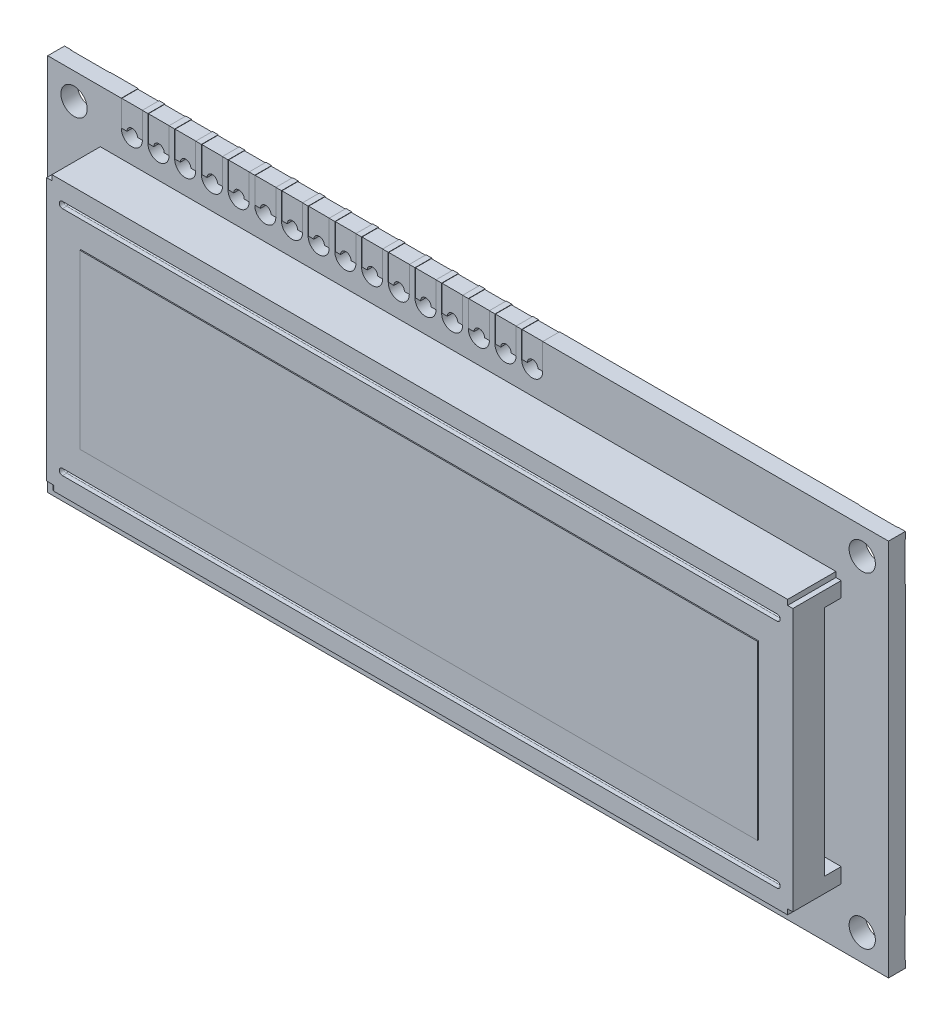
from build123d import *

# Parameters (mm, degrees)
SKETCH1_W                         = 70
SKETCH1_H                         = 26
BOSS_EXTRUDE1_DEPTH               = 4.6
SKETCH2_W                         = 4.6
SKETCH2_H                         = 25
BOSS_EXTRUDE2_DEPTH               = 0.5
SKETCH3_W                         = 4.6
SKETCH3_H                         = 25
BOSS_EXTRUDE3_DEPTH               = 0.5
SKETCH4_W                         = 71
SKETCH4_H                         = 1.6
CUT_EXTRUDE1_DEPTH                = 22.135688782
SKETCH5_W                         = 80
SKETCH5_H                         = 36
BOSS_EXTRUDE4_DEPTH               = 1.6
CUT_EXTRUDE2_DEPTH                = 45.103968075
CUT_EXTRUDE3_DEPTH                = 45.103968075
CUT_EXTRUDE4_DEPTH                = 45.103968075
CUT_EXTRUDE5_DEPTH                = 45.103968075
CUT_EXTRUDE6_DEPTH                = 45.103968075
CUT_EXTRUDE7_DEPTH                = 45.103968075
CUT_EXTRUDE8_DEPTH                = 45.103968075
CUT_EXTRUDE9_DEPTH                = 45.103968075
CUT_EXTRUDE10_DEPTH               = 45.103968075
CUT_EXTRUDE11_DEPTH               = 45.103968075
CUT_EXTRUDE12_DEPTH               = 45.103968075
CUT_EXTRUDE13_DEPTH               = 45.103968075
CUT_EXTRUDE14_DEPTH               = 45.103968075
CUT_EXTRUDE15_DEPTH               = 45.103968075
CUT_EXTRUDE16_DEPTH               = 45.103968075
SKETCH21_W                        = 1.52
SKETCH21_H                        = 2.47
BOSS_EXTRUDE5_DEPTH               = 2
SKETCH22_W                        = 1.52
SKETCH22_H                        = 2.47
BOSS_EXTRUDE6_DEPTH               = 2
SKETCH23_W                        = 1.52
SKETCH23_H                        = 2.47
BOSS_EXTRUDE7_DEPTH               = 2
SKETCH24_W                        = 1.52
SKETCH24_H                        = 2.47
BOSS_EXTRUDE8_DEPTH               = 2
SKETCH25_W                        = 1.52
SKETCH25_H                        = 2.47
BOSS_EXTRUDE9_DEPTH               = 2
SKETCH26_W                        = 1.52
SKETCH26_H                        = 2.47
BOSS_EXTRUDE10_DEPTH              = 2
SKETCH27_W                        = 1.52
SKETCH27_H                        = 2.47
BOSS_EXTRUDE11_DEPTH              = 2
SKETCH28_W                        = 1.52
SKETCH28_H                        = 2.47
BOSS_EXTRUDE12_DEPTH              = 2
SKETCH29_W                        = 1.52
SKETCH29_H                        = 2.47
BOSS_EXTRUDE13_DEPTH              = 2
SKETCH30_W                        = 1.52
SKETCH30_H                        = 2.47
BOSS_EXTRUDE14_DEPTH              = 2
SKETCH31_W                        = 1.52
SKETCH31_H                        = 2.47
BOSS_EXTRUDE15_DEPTH              = 2
SKETCH32_W                        = 1.52
SKETCH32_H                        = 2.47
BOSS_EXTRUDE16_DEPTH              = 2
SKETCH33_W                        = 1.52
SKETCH33_H                        = 2.47
BOSS_EXTRUDE17_DEPTH              = 2
SKETCH34_W                        = 1.52
SKETCH34_H                        = 2.47
BOSS_EXTRUDE18_DEPTH              = 2
SKETCH35_W                        = 1.52
SKETCH35_H                        = 2.47
BOSS_EXTRUDE19_DEPTH              = 2
CUT_EXTRUDE17_DEPTH               = 45.103968075
SKETCH37_W                        = 1.52
SKETCH37_H                        = 2.47
BOSS_EXTRUDE20_DEPTH              = 2
SKETCH38_W                        = 64.5
SKETCH38_H                        = 16.4
BOSS_EXTRUDE21_DEPTH              = 0.1
SKETCH39_W                        = 0.8
SKETCH39_H                        = 0.5
BOSS_EXTRUDE22_DEPTH              = 0.6
SKETCH40_W                        = 0.8
SKETCH40_H                        = 0.5
BOSS_EXTRUDE23_DEPTH              = 0.6
SKETCH41_W                        = 0.8
SKETCH41_H                        = 0.5
BOSS_EXTRUDE24_DEPTH              = 0.6
SKETCH42_W                        = 0.8
SKETCH42_H                        = 0.5
BOSS_EXTRUDE25_DEPTH              = 0.6
SKETCH43_W                        = 0.8
SKETCH43_H                        = 0.5
BOSS_EXTRUDE26_DEPTH              = 0.6
SKETCH44_W                        = 0.8
SKETCH44_H                        = 0.5
BOSS_EXTRUDE27_DEPTH              = 0.6
SKETCH45_W                        = 0.8
SKETCH45_H                        = 0.5
BOSS_EXTRUDE28_DEPTH              = 0.6
SKETCH46_W                        = 0.8
SKETCH46_H                        = 0.5
BOSS_EXTRUDE29_DEPTH              = 0.6
SKETCH47_W                        = 0.8
SKETCH47_H                        = 0.5
BOSS_EXTRUDE30_DEPTH              = 0.6
SKETCH48_W                        = 0.8
SKETCH48_H                        = 0.5
BOSS_EXTRUDE31_DEPTH              = 0.6
SKETCH49_W                        = 0.8
SKETCH49_H                        = 0.5
BOSS_EXTRUDE32_DEPTH              = 0.6
SKETCH50_W                        = 0.8
SKETCH50_H                        = 0.5
BOSS_EXTRUDE33_DEPTH              = 0.6
CUT_EXTRUDE18_DEPTH               = 0.5
CUT_EXTRUDE19_DEPTH               = 0.5
M2_5X0_45_TAPPED_HOLE1_AT_2_COUNT = 2
M2_5X0_45_TAPPED_HOLE1_AT_2_PITCH = 75
M2_5X0_45_TAPPED_HOLE1_AT_3_COUNT = 2
M2_5X0_45_TAPPED_HOLE1_AT_3_PITCH = 31
M2_5X0_45_TAPPED_HOLE1_AT_4_COUNT = 2
M2_5X0_45_TAPPED_HOLE1_AT_4_PITCH = 81.154174261
F_1_0_1_DIAMETER_HOLE1_D          = 1
F_1_0_1_DIAMETER_HOLE1_DEPTH      = 2.56
RIB1_REACH                        = 48.446
SKETCH59_WALL_W                   = 95.39246471
SKETCH59_WALL_H                   = 0.2
RIB2_REACH                        = 47.053
SKETCH60_WALL_W                   = 92.605549218
SKETCH60_WALL_H                   = 0.2
RIB3_REACH                        = 47.965
SKETCH61_WALL_W                   = 94.429375066
SKETCH61_WALL_H                   = 0.2
RIB4_REACH                        = 46.623
SKETCH62_WALL_W                   = 91.746904708
SKETCH62_WALL_H                   = 0.2
RIB5_REACH                        = 47.5
SKETCH63_WALL_W                   = 93.500054946
SKETCH63_WALL_H                   = 0.2
RIB6_REACH                        = 46.416
SKETCH64_WALL_W                   = 91.331357076
SKETCH64_WALL_H                   = 0.2
FILLET2_R                         = 0.2
CHAMFER1_SIZE                     = 0.05
FILLET3_R                         = 0.1


with BuildPart() as part:
    # Sketch1 → Boss-Extrude1 (new body)
    with BuildSketch(Plane.XY.offset(6.2)):
        Rectangle(SKETCH1_W, SKETCH1_H)
    extrude(amount=-BOSS_EXTRUDE1_DEPTH)

    # Sketch2 → Boss-Extrude2 (add)
    with BuildSketch(Plane.ZY.offset(35)):
        with Locations((3.9, 0)):
            Rectangle(SKETCH2_W, SKETCH2_H)
    extrude(amount=BOSS_EXTRUDE2_DEPTH)

    # Sketch3 → Boss-Extrude3 (add)
    with BuildSketch(Plane(origin=(35, 0, 0), x_dir=(0, 0, -1), z_dir=(1, 0, 0))):
        with Locations((-3.9, 0)):
            Rectangle(SKETCH3_W, SKETCH3_H)
    extrude(amount=BOSS_EXTRUDE3_DEPTH)

    # Sketch4 → Cut-Extrude1 (cut)
    with BuildSketch(Plane(origin=(0, 11.067844391, 0), x_dir=(1, 0, 0), z_dir=(0, 1, 0))):
        with Locations((0, -2.4)):
            Rectangle(SKETCH4_W, SKETCH4_H)
    extrude(amount=-CUT_EXTRUDE1_DEPTH, mode=Mode.SUBTRACT)

    # Sketch5 → Boss-Extrude4 (add)
    with BuildSketch(Plane.XY.offset(1.6)):
        Rectangle(SKETCH5_W, SKETCH5_H)
    extrude(amount=-BOSS_EXTRUDE4_DEPTH)

    # Sketch6 → Cut-Extrude2 (cut, through all)
    with BuildSketch(Plane.XY.offset(1.6)):
        with BuildLine():
            Line((-31, 18), (-33, 18))
            Line((-33, 18), (-33, 15.5))
            ThreePointArc((-33, 15.5), (-32, 14.5), (-31, 15.5))
            Line((-31, 15.5), (-31, 18))
        make_face()
    extrude(amount=-CUT_EXTRUDE2_DEPTH, mode=Mode.SUBTRACT)

    # Sketch7 → Cut-Extrude3 (cut, through all)
    with BuildSketch(Plane.XY.offset(1.6)):
        with BuildLine():
            Line((-28.46, 18), (-30.46, 18))
            Line((-30.46, 18), (-30.46, 15.5))
            ThreePointArc((-30.46, 15.5), (-29.46, 14.5), (-28.46, 15.5))
            Line((-28.46, 15.5), (-28.46, 18))
        make_face()
    extrude(amount=-CUT_EXTRUDE3_DEPTH, mode=Mode.SUBTRACT)

    # Sketch8 → Cut-Extrude4 (cut, through all)
    with BuildSketch(Plane.XY.offset(1.6)):
        with BuildLine():
            Line((-25.92, 18), (-27.92, 18))
            Line((-27.92, 18), (-27.92, 15.5))
            ThreePointArc((-27.92, 15.5), (-26.92, 14.5), (-25.92, 15.5))
            Line((-25.92, 15.5), (-25.92, 18))
        make_face()
    extrude(amount=-CUT_EXTRUDE4_DEPTH, mode=Mode.SUBTRACT)

    # Sketch9 → Cut-Extrude5 (cut, through all)
    with BuildSketch(Plane.XY.offset(1.6)):
        with BuildLine():
            Line((-23.38, 18), (-25.38, 18))
            Line((-25.38, 18), (-25.38, 15.5))
            ThreePointArc((-25.38, 15.5), (-24.38, 14.5), (-23.38, 15.5))
            Line((-23.38, 15.5), (-23.38, 18))
        make_face()
    extrude(amount=-CUT_EXTRUDE5_DEPTH, mode=Mode.SUBTRACT)

    # Sketch10 → Cut-Extrude6 (cut, through all)
    with BuildSketch(Plane.XY.offset(1.6)):
        with BuildLine():
            Line((-20.84, 18), (-22.84, 18))
            Line((-22.84, 18), (-22.84, 15.5))
            ThreePointArc((-22.84, 15.5), (-21.84, 14.5), (-20.84, 15.5))
            Line((-20.84, 15.5), (-20.84, 18))
        make_face()
    extrude(amount=-CUT_EXTRUDE6_DEPTH, mode=Mode.SUBTRACT)

    # Sketch11 → Cut-Extrude7 (cut, through all)
    with BuildSketch(Plane.XY.offset(1.6)):
        with BuildLine():
            Line((-18.3, 18), (-20.3, 18))
            Line((-20.3, 18), (-20.3, 15.5))
            ThreePointArc((-20.3, 15.5), (-19.3, 14.5), (-18.3, 15.5))
            Line((-18.3, 15.5), (-18.3, 18))
        make_face()
    extrude(amount=-CUT_EXTRUDE7_DEPTH, mode=Mode.SUBTRACT)

    # Sketch12 → Cut-Extrude8 (cut, through all)
    with BuildSketch(Plane.XY.offset(1.6)):
        with BuildLine():
            Line((-15.76, 18), (-17.76, 18))
            Line((-17.76, 18), (-17.76, 15.5))
            ThreePointArc((-17.76, 15.5), (-16.76, 14.5), (-15.76, 15.5))
            Line((-15.76, 15.5), (-15.76, 18))
        make_face()
    extrude(amount=-CUT_EXTRUDE8_DEPTH, mode=Mode.SUBTRACT)

    # Sketch13 → Cut-Extrude9 (cut, through all)
    with BuildSketch(Plane.XY.offset(1.6)):
        with BuildLine():
            Line((-13.22, 18), (-15.22, 18))
            Line((-15.22, 18), (-15.22, 15.5))
            ThreePointArc((-15.22, 15.5), (-14.22, 14.5), (-13.22, 15.5))
            Line((-13.22, 15.5), (-13.22, 18))
        make_face()
    extrude(amount=-CUT_EXTRUDE9_DEPTH, mode=Mode.SUBTRACT)

    # Sketch14 → Cut-Extrude10 (cut, through all)
    with BuildSketch(Plane.XY.offset(1.6)):
        with BuildLine():
            Line((-10.68, 18), (-12.68, 18))
            Line((-12.68, 18), (-12.68, 15.5))
            ThreePointArc((-12.68, 15.5), (-11.68, 14.5), (-10.68, 15.5))
            Line((-10.68, 15.5), (-10.68, 18))
        make_face()
    extrude(amount=-CUT_EXTRUDE10_DEPTH, mode=Mode.SUBTRACT)

    # Sketch15 → Cut-Extrude11 (cut, through all)
    with BuildSketch(Plane.XY.offset(1.6)):
        with BuildLine():
            Line((-8.14, 18), (-10.14, 18))
            Line((-10.14, 18), (-10.14, 15.5))
            ThreePointArc((-10.14, 15.5), (-9.14, 14.5), (-8.14, 15.5))
            Line((-8.14, 15.5), (-8.14, 18))
        make_face()
    extrude(amount=-CUT_EXTRUDE11_DEPTH, mode=Mode.SUBTRACT)

    # Sketch16 → Cut-Extrude12 (cut, through all)
    with BuildSketch(Plane.XY.offset(1.6)):
        with BuildLine():
            Line((-5.6, 18), (-7.6, 18))
            Line((-7.6, 18), (-7.6, 15.5))
            ThreePointArc((-7.6, 15.5), (-6.6, 14.5), (-5.6, 15.5))
            Line((-5.6, 15.5), (-5.6, 18))
        make_face()
    extrude(amount=-CUT_EXTRUDE12_DEPTH, mode=Mode.SUBTRACT)

    # Sketch17 → Cut-Extrude13 (cut, through all)
    with BuildSketch(Plane.XY.offset(1.6)):
        with BuildLine():
            Line((-3.06, 18), (-5.06, 18))
            Line((-5.06, 18), (-5.06, 15.5))
            ThreePointArc((-5.06, 15.5), (-4.06, 14.5), (-3.06, 15.5))
            Line((-3.06, 15.5), (-3.06, 18))
        make_face()
    extrude(amount=-CUT_EXTRUDE13_DEPTH, mode=Mode.SUBTRACT)

    # Sketch18 → Cut-Extrude14 (cut, through all)
    with BuildSketch(Plane.XY.offset(1.6)):
        with BuildLine():
            Line((-0.52, 18), (-2.52, 18))
            Line((-2.52, 18), (-2.52, 15.5))
            ThreePointArc((-2.52, 15.5), (-1.52, 14.5), (-0.52, 15.5))
            Line((-0.52, 15.5), (-0.52, 18))
        make_face()
    extrude(amount=-CUT_EXTRUDE14_DEPTH, mode=Mode.SUBTRACT)

    # Sketch19 → Cut-Extrude15 (cut, through all)
    with BuildSketch(Plane.XY.offset(1.6)):
        with BuildLine():
            Line((2.02, 18), (0.02, 18))
            Line((0.02, 18), (0.02, 15.5))
            ThreePointArc((0.02, 15.5), (1.02, 14.5), (2.02, 15.5))
            Line((2.02, 15.5), (2.02, 18))
        make_face()
    extrude(amount=-CUT_EXTRUDE15_DEPTH, mode=Mode.SUBTRACT)

    # Sketch20 → Cut-Extrude16 (cut, through all)
    with BuildSketch(Plane.XY.offset(1.6)):
        with BuildLine():
            Line((5.1, 18), (5.1, 15.5))
            ThreePointArc((5.1, 15.5), (6.1, 14.5), (7.1, 15.5))
            Line((7.1, 15.5), (7.1, 18))
            Line((7.1, 18), (5.1, 18))
        make_face()
    extrude(amount=-CUT_EXTRUDE16_DEPTH, mode=Mode.SUBTRACT)

    # Sketch21 → Boss-Extrude5 (add)
    with BuildSketch(Plane.ZY.offset(31)):
        with Locations((0.8, 16.735)):
            Rectangle(SKETCH21_W, SKETCH21_H)
    extrude(amount=BOSS_EXTRUDE5_DEPTH)

    # Sketch22 → Boss-Extrude6 (add)
    with BuildSketch(Plane.ZY.offset(28.46)):
        with Locations((0.8, 16.735)):
            Rectangle(SKETCH22_W, SKETCH22_H)
    extrude(amount=BOSS_EXTRUDE6_DEPTH)

    # Sketch23 → Boss-Extrude7 (add)
    with BuildSketch(Plane.ZY.offset(25.92)):
        with Locations((0.8, 16.735)):
            Rectangle(SKETCH23_W, SKETCH23_H)
    extrude(amount=BOSS_EXTRUDE7_DEPTH)

    # Sketch24 → Boss-Extrude8 (add)
    with BuildSketch(Plane.ZY.offset(23.38)):
        with Locations((0.8, 16.735)):
            Rectangle(SKETCH24_W, SKETCH24_H)
    extrude(amount=BOSS_EXTRUDE8_DEPTH)

    # Sketch25 → Boss-Extrude9 (add)
    with BuildSketch(Plane.ZY.offset(20.84)):
        with Locations((0.8, 16.735)):
            Rectangle(SKETCH25_W, SKETCH25_H)
    extrude(amount=BOSS_EXTRUDE9_DEPTH)

    # Sketch26 → Boss-Extrude10 (add)
    with BuildSketch(Plane.ZY.offset(18.3)):
        with Locations((0.8, 16.735)):
            Rectangle(SKETCH26_W, SKETCH26_H)
    extrude(amount=BOSS_EXTRUDE10_DEPTH)

    # Sketch27 → Boss-Extrude11 (add)
    with BuildSketch(Plane.ZY.offset(15.76)):
        with Locations((0.8, 16.735)):
            Rectangle(SKETCH27_W, SKETCH27_H)
    extrude(amount=BOSS_EXTRUDE11_DEPTH)

    # Sketch28 → Boss-Extrude12 (add)
    with BuildSketch(Plane.ZY.offset(13.22)):
        with Locations((0.8, 16.735)):
            Rectangle(SKETCH28_W, SKETCH28_H)
    extrude(amount=BOSS_EXTRUDE12_DEPTH)

    # Sketch29 → Boss-Extrude13 (add)
    with BuildSketch(Plane.ZY.offset(10.68)):
        with Locations((0.8, 16.735)):
            Rectangle(SKETCH29_W, SKETCH29_H)
    extrude(amount=BOSS_EXTRUDE13_DEPTH)

    # Sketch30 → Boss-Extrude14 (add)
    with BuildSketch(Plane.ZY.offset(8.14)):
        with Locations((0.8, 16.735)):
            Rectangle(SKETCH30_W, SKETCH30_H)
    extrude(amount=BOSS_EXTRUDE14_DEPTH)

    # Sketch31 → Boss-Extrude15 (add)
    with BuildSketch(Plane.ZY.offset(5.6)):
        with Locations((0.8, 16.735)):
            Rectangle(SKETCH31_W, SKETCH31_H)
    extrude(amount=BOSS_EXTRUDE15_DEPTH)

    # Sketch32 → Boss-Extrude16 (add)
    with BuildSketch(Plane.ZY.offset(3.06)):
        with Locations((0.8, 16.735)):
            Rectangle(SKETCH32_W, SKETCH32_H)
    extrude(amount=BOSS_EXTRUDE16_DEPTH)

    # Sketch33 → Boss-Extrude17 (add)
    with BuildSketch(Plane.ZY.offset(0.52)):
        with Locations((0.8, 16.735)):
            Rectangle(SKETCH33_W, SKETCH33_H)
    extrude(amount=BOSS_EXTRUDE17_DEPTH)

    # Sketch34 → Boss-Extrude18 (add)
    with BuildSketch(Plane.ZY.offset(-2.02)):
        with Locations((0.8, 16.735)):
            Rectangle(SKETCH34_W, SKETCH34_H)
    extrude(amount=BOSS_EXTRUDE18_DEPTH)

    # Sketch35 → Boss-Extrude19 (add)
    with BuildSketch(Plane.ZY.offset(-7.1)):
        with Locations((0.8, 16.735)):
            Rectangle(SKETCH35_W, SKETCH35_H)
    extrude(amount=BOSS_EXTRUDE19_DEPTH)

    # Sketch36 → Cut-Extrude17 (cut, through all)
    with BuildSketch(Plane.XY.offset(1.6)):
        with BuildLine():
            Line((4.56, 18), (2.56, 18))
            Line((2.56, 18), (2.56, 15.5))
            ThreePointArc((2.56, 15.5), (3.56, 14.5), (4.56, 15.5))
            Line((4.56, 15.5), (4.56, 18))
        make_face()
    extrude(amount=-CUT_EXTRUDE17_DEPTH, mode=Mode.SUBTRACT)

    # Sketch37 → Boss-Extrude20 (add)
    with BuildSketch(Plane.ZY.offset(-4.56)):
        with Locations((0.8, 16.735)):
            Rectangle(SKETCH37_W, SKETCH37_H)
    extrude(amount=BOSS_EXTRUDE20_DEPTH)

    # Sketch38 → Boss-Extrude21 (add)
    with BuildSketch(Plane.XY.offset(6.2)):
        Rectangle(SKETCH38_W, SKETCH38_H)
    extrude(amount=BOSS_EXTRUDE21_DEPTH)

    # Sketch39 → Boss-Extrude22 (add)
    with BuildSketch(Plane(origin=(0, 0, 0), x_dir=(-1, 0, 0), z_dir=(0, 0, -1))):
        with Locations((-30.3, 0.25)):
            Rectangle(SKETCH39_W, SKETCH39_H)
    extrude(amount=BOSS_EXTRUDE22_DEPTH)

    # Sketch40 → Boss-Extrude23 (add)
    with BuildSketch(Plane(origin=(0, 0, 0), x_dir=(-1, 0, 0), z_dir=(0, 0, -1))):
        with Locations((-31.6, 0.25)):
            Rectangle(SKETCH40_W, SKETCH40_H)
    extrude(amount=BOSS_EXTRUDE23_DEPTH)

    # Sketch41 → Boss-Extrude24 (add)
    with BuildSketch(Plane(origin=(0, 0, 0), x_dir=(-1, 0, 0), z_dir=(0, 0, -1))):
        with Locations((-30.3, -1.75)):
            Rectangle(SKETCH41_W, SKETCH41_H)
    extrude(amount=BOSS_EXTRUDE24_DEPTH)

    # Sketch42 → Boss-Extrude25 (add)
    with BuildSketch(Plane(origin=(0, 0, 0), x_dir=(-1, 0, 0), z_dir=(0, 0, -1))):
        with Locations((-31.6, -1.75)):
            Rectangle(SKETCH42_W, SKETCH42_H)
    extrude(amount=BOSS_EXTRUDE25_DEPTH)

    # Sketch43 → Boss-Extrude26 (add)
    with BuildSketch(Plane(origin=(0, 0, 0), x_dir=(-1, 0, 0), z_dir=(0, 0, -1))):
        with Locations((-30.3, -2.75)):
            Rectangle(SKETCH43_W, SKETCH43_H)
    extrude(amount=BOSS_EXTRUDE26_DEPTH)

    # Sketch44 → Boss-Extrude27 (add)
    with BuildSketch(Plane(origin=(0, 0, 0), x_dir=(-1, 0, 0), z_dir=(0, 0, -1))):
        with Locations((-31.6, -2.75)):
            Rectangle(SKETCH44_W, SKETCH44_H)
    extrude(amount=BOSS_EXTRUDE27_DEPTH)

    # Sketch45 → Boss-Extrude28 (add)
    with BuildSketch(Plane(origin=(0, 0, 0), x_dir=(-1, 0, 0), z_dir=(0, 0, -1))):
        with Locations((-30.3, -3.75)):
            Rectangle(SKETCH45_W, SKETCH45_H)
    extrude(amount=BOSS_EXTRUDE28_DEPTH)

    # Sketch46 → Boss-Extrude29 (add)
    with BuildSketch(Plane(origin=(0, 0, 0), x_dir=(-1, 0, 0), z_dir=(0, 0, -1))):
        with Locations((-31.6, -3.75)):
            Rectangle(SKETCH46_W, SKETCH46_H)
    extrude(amount=BOSS_EXTRUDE29_DEPTH)

    # Sketch47 → Boss-Extrude30 (add)
    with BuildSketch(Plane(origin=(0, 0, 0), x_dir=(-1, 0, 0), z_dir=(0, 0, -1))):
        with Locations((-30.3, -4.75)):
            Rectangle(SKETCH47_W, SKETCH47_H)
    extrude(amount=BOSS_EXTRUDE30_DEPTH)

    # Sketch48 → Boss-Extrude31 (add)
    with BuildSketch(Plane(origin=(0, 0, 0), x_dir=(-1, 0, 0), z_dir=(0, 0, -1))):
        with Locations((-31.6, -4.75)):
            Rectangle(SKETCH48_W, SKETCH48_H)
    extrude(amount=BOSS_EXTRUDE31_DEPTH)

    # Sketch49 → Boss-Extrude32 (add)
    with BuildSketch(Plane(origin=(0, 0, 0), x_dir=(-1, 0, 0), z_dir=(0, 0, -1))):
        with Locations((-31.6, -0.75)):
            Rectangle(SKETCH49_W, SKETCH49_H)
    extrude(amount=BOSS_EXTRUDE32_DEPTH)

    # Sketch50 → Boss-Extrude33 (add)
    with BuildSketch(Plane(origin=(0, 0, 0), x_dir=(-1, 0, 0), z_dir=(0, 0, -1))):
        with Locations((-30.3, -0.75)):
            Rectangle(SKETCH50_W, SKETCH50_H)
    extrude(amount=BOSS_EXTRUDE33_DEPTH)

    # Sketch51 → Cut-Extrude18 (cut)
    with BuildSketch(Plane.XY.offset(6.2)):
        with BuildLine():
            Line((34, -10.7), (-34, -10.7))
            ThreePointArc((-34, -10.7), (-34.3, -11), (-34, -11.3))
            Line((-34, -11.3), (34, -11.3))
            ThreePointArc((34, -11.3), (34.3, -11), (34, -10.7))
        make_face()
    extrude(amount=-CUT_EXTRUDE18_DEPTH, mode=Mode.SUBTRACT)

    # Sketch52 → Cut-Extrude19 (cut)
    with BuildSketch(Plane.XY.offset(6.2)):
        with BuildLine():
            Line((34, 11.3), (-34, 11.3))
            ThreePointArc((-34, 11.3), (-34.3, 11), (-34, 10.7))
            Line((-34, 10.7), (34, 10.7))
            ThreePointArc((34, 10.7), (34.3, 11), (34, 11.3))
        make_face()
    extrude(amount=-CUT_EXTRUDE19_DEPTH, mode=Mode.SUBTRACT)

    # Sketch53 → Revolve1 (revolve)
    with BuildSketch(Plane.XZ):
        with BuildLine():
            Line((-9.662109618, 0), (-14.018673897, 0))
            Line((-14.018673897, 0), (-14.018673897, -1))
            Line((-14.018673897, -1), (-11.394160426, -1))
            ThreePointArc((-11.394160426, -1), (-10.894160426, -0.866025404), (-10.528135022, -0.5))
            ThreePointArc((-10.528135022, -0.5), (-10.162109618, -0.133974596), (-9.662109618, 0))
        make_face()
    revolve(axis=Axis((-14.018673897, 0, 0), (0, 0, -1)))

    # Sketch54 → Revolve2 (revolve)
    with BuildSketch(Plane.XZ):
        with BuildLine():
            Line((23.145008603, 0), (17.197547913, 0))
            Line((17.197547913, 0), (17.197547913, -1))
            Line((17.197547913, -1), (21.412957795, -1))
            ThreePointArc((21.412957795, -1), (21.912957795, -0.866025404), (22.278983199, -0.5))
            ThreePointArc((22.278983199, -0.5), (22.645008603, -0.133974596), (23.145008603, 0))
        make_face()
    revolve(axis=Axis((17.197547913, 0, 0), (0, 0, -1)))

    # Sketch55 → M2.5x0.45 Tapped Hole1 (revolve, cut)
    with BuildSketch(Plane(origin=(-37.5, -15.5, 1.6), x_dir=(0, -1, 0), z_dir=(1, 0, 0))):
        Polygon((0, 0), (0, 2.6), (3.1, 2.6), (3.1, 1.56), (1.25, 1.56), (1.25, 0), align=None)
    m2_5x0_45_tapped_hole1 = revolve(axis=Axis((-37.5, -15.5, 7.95), (0, 0, -1)), mode=Mode.SUBTRACT)

    # M2.5x0.45 Tapped Hole1 at 2: M2.5x0.45 Tapped Hole1 ×2
    with Locations(*[(i * M2_5X0_45_TAPPED_HOLE1_AT_2_PITCH, 0, 0) for i in range(1, M2_5X0_45_TAPPED_HOLE1_AT_2_COUNT)]):
        add(m2_5x0_45_tapped_hole1, mode=Mode.SUBTRACT)

    # M2.5x0.45 Tapped Hole1 at 3: M2.5x0.45 Tapped Hole1 ×2
    with Locations(*[(0, i * M2_5X0_45_TAPPED_HOLE1_AT_3_PITCH, 0) for i in range(1, M2_5X0_45_TAPPED_HOLE1_AT_3_COUNT)]):
        add(m2_5x0_45_tapped_hole1, mode=Mode.SUBTRACT)

    # M2.5x0.45 Tapped Hole1 at 4: M2.5x0.45 Tapped Hole1 ×2
    with Locations(*[Vector(0.9241668796814523, 0.3819889769350003, 0) * (i * M2_5X0_45_TAPPED_HOLE1_AT_4_PITCH) for i in range(1, M2_5X0_45_TAPPED_HOLE1_AT_4_COUNT)]):
        add(m2_5x0_45_tapped_hole1, mode=Mode.SUBTRACT)

    # Ø1.0 (1) Diameter Hole1
    with Locations(Plane.XY.offset(1.56)):
        with Locations((6.1, 15.5), (-32, 15.5), (-29.46, 15.5), (-26.92, 15.5), (-24.38, 15.5), (-21.84, 15.5), (-19.3, 15.5), (-16.76, 15.5), (-14.22, 15.5), (-11.68, 15.5), (-9.14, 15.5), (-6.6, 15.5), (-4.06, 15.5), (-1.52, 15.5), (1.02, 15.5), (3.56, 15.5)):
            Hole(F_1_0_1_DIAMETER_HOLE1_D / 2, depth=F_1_0_1_DIAMETER_HOLE1_DEPTH)

    # Sketch59 wall → Rib1 (add, up to next)
    with BuildSketch(Plane(origin=(30.95, -4.75, -0.5), x_dir=(-1, 0, 0), z_dir=(0, 0, 1)), mode=Mode.PRIVATE) as rib1_sk1:
        Rectangle(SKETCH59_WALL_W, SKETCH59_WALL_H)
    rib1_tool1 = extrude(rib1_sk1.sketch, amount=RIB1_REACH, mode=Mode.PRIVATE) - part.part
    add(rib1_tool1.solids().sort_by_distance((30.95, -4.75, -0.5))[0])

    # Sketch60 wall → Rib2 (add, up to next)
    with BuildSketch(Plane(origin=(30.95, -1.75, -0.5), x_dir=(-1, 0, 0), z_dir=(0, 0, 1)), mode=Mode.PRIVATE) as rib2_sk1:
        Rectangle(SKETCH60_WALL_W, SKETCH60_WALL_H)
    rib2_tool1 = extrude(rib2_sk1.sketch, amount=RIB2_REACH, mode=Mode.PRIVATE) - part.part
    add(rib2_tool1.solids().sort_by_distance((30.95, -1.75, -0.5))[0])

    # Sketch61 wall → Rib3 (add, up to next)
    with BuildSketch(Plane(origin=(30.95, -3.75, -0.5), x_dir=(-1, 0, 0), z_dir=(0, 0, 1)), mode=Mode.PRIVATE) as rib3_sk1:
        Rectangle(SKETCH61_WALL_W, SKETCH61_WALL_H)
    rib3_tool1 = extrude(rib3_sk1.sketch, amount=RIB3_REACH, mode=Mode.PRIVATE) - part.part
    add(rib3_tool1.solids().sort_by_distance((30.95, -3.75, -0.5))[0])

    # Sketch62 wall → Rib4 (add, up to next)
    with BuildSketch(Plane(origin=(30.95, -0.75, -0.5), x_dir=(-1, 0, 0), z_dir=(0, 0, 1)), mode=Mode.PRIVATE) as rib4_sk1:
        Rectangle(SKETCH62_WALL_W, SKETCH62_WALL_H)
    rib4_tool1 = extrude(rib4_sk1.sketch, amount=RIB4_REACH, mode=Mode.PRIVATE) - part.part
    add(rib4_tool1.solids().sort_by_distance((30.95, -0.75, -0.5))[0])

    # Sketch63 wall → Rib5 (add, up to next)
    with BuildSketch(Plane(origin=(30.95, -2.75, -0.5), x_dir=(-1, 0, 0), z_dir=(0, 0, 1)), mode=Mode.PRIVATE) as rib5_sk1:
        Rectangle(SKETCH63_WALL_W, SKETCH63_WALL_H)
    rib5_tool1 = extrude(rib5_sk1.sketch, amount=RIB5_REACH, mode=Mode.PRIVATE) - part.part
    add(rib5_tool1.solids().sort_by_distance((30.95, -2.75, -0.5))[0])

    # Sketch64 wall → Rib6 (add, up to next)
    with BuildSketch(Plane(origin=(30.95, 0.25, -0.5), x_dir=(-1, 0, 0), z_dir=(0, 0, 1)), mode=Mode.PRIVATE) as rib6_sk1:
        Rectangle(SKETCH64_WALL_W, SKETCH64_WALL_H)
    rib6_tool1 = extrude(rib6_sk1.sketch, amount=RIB6_REACH, mode=Mode.PRIVATE) - part.part
    add(rib6_tool1.solids().sort_by_distance((30.95, 0.25, -0.5))[0])

    # Fillet2
    fillet2_edges = [part.edges().sort_by_distance(p)[0] for p in [
        (-35, -12.75, 6.2),
    ]]
    fillet(fillet2_edges, radius=FILLET2_R)

    # Chamfer1
    chamfer1_edges = [part.edges().sort_by_distance(p)[0] for p in [
        (30.95, -2.65, -0.5),
        (30.95, -4.65, -0.5),
        (30.95, -0.85, -0.5),
        (30.95, -3.65, -0.5),
        (30.95, -1.85, -0.5),
        (30.95, -3.85, -0.5),
        (30.95, -1.65, -0.5),
        (30.95, -4.85, -0.5),
        (30.95, -2.85, -0.5),
        (30.95, 0.35, -0.5),
        (30.95, -0.65, -0.5),
        (30.95, 0.15, -0.5),
    ]]
    chamfer(chamfer1_edges, length=CHAMFER1_SIZE)

    # Fillet3
    fillet3_edges = [part.edges().sort_by_distance(p)[0] for p in [
        (34.3, -11, 5.7),
        (0, -11.3, 5.7),
        (0, -10.7, 5.7),
        (-34.3, -11, 5.7),
        (0, 10.7, 5.7),
        (-34.3, 11, 5.7),
        (34.3, 11, 5.7),
        (0, 11.3, 5.7),
    ]]
    fillet(fillet3_edges, radius=FILLET3_R)


solid = part.part
